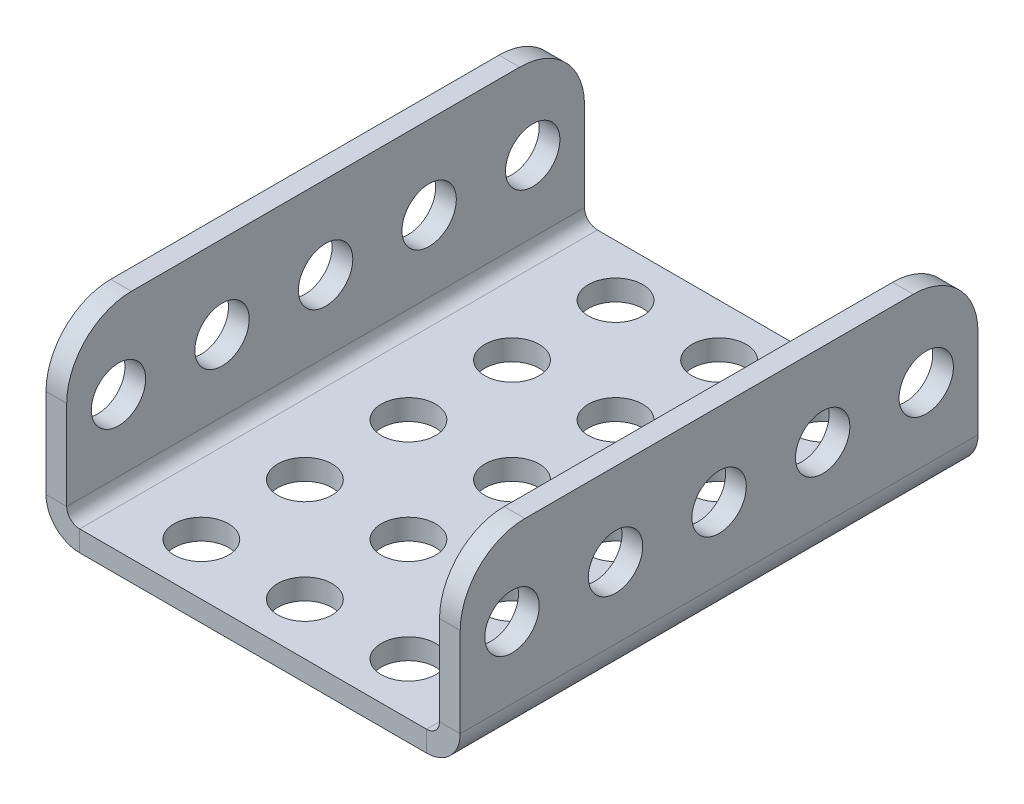
from build123d import *

# Parameters (mm, degrees)
SKETCH1_W                      = 32
SKETCH1_H                      = 40
BOSS_EXTRUDE1_DEPTH            = 1.6
SKETCH2_R                      = 2.1
CUT_EXTRUDE1_DEPTH             = 52.24997561
LPATTERN1_COUNT                = 3
LPATTERN1_PITCH                = 8
LPATTERN1_COUNT_DIR2           = 5
LPATTERN1_PITCH_DIR2           = 8
EDGE_FLANGE1_STRIP_W           = 8.4
EDGE_FLANGE1_STRIP_H           = 1.6
EDGE_FLANGE1_STRIP_CUT_DEPTH   = 40
EDGE_FLANGE1_STRIP_2_W         = 8.4
EDGE_FLANGE1_STRIP_2_H         = 1.6
EDGE_FLANGE1_STRIP_CUT_2_DEPTH = 40
EDGE_FLANGE1_DEPTH             = 40
EDGE_FLANGE1_BEND_DEPTH        = 40
FILLET1_R                      = 5
SKETCH14_R                     = 2.1
CUT_EXTRUDE2_DEPTH             = 54.23767463
LPATTERN2_COUNT                = 5
LPATTERN2_PITCH                = 8


# Sheet-metal steps are written as plain solids
with BuildPart() as part:
    # Sketch1 → Boss-Extrude1 (new body)
    with BuildSketch(Plane(origin=(0, 0, 0), x_dir=(1, 0, 0), z_dir=(0, 1, 0))):
        with Locations((16, -20)):
            Rectangle(SKETCH1_W, SKETCH1_H)
    extrude(amount=BOSS_EXTRUDE1_DEPTH)

    # Sketch2 → Cut-Extrude1 (cut, through all)
    with BuildSketch(Plane(origin=(0, 1.6, 0), x_dir=(1, 0, 0), z_dir=(0, 1, 0))):
        with Locations(Location((8, -4, 0), (0, 0, 270))):
            Circle(SKETCH2_R)
    cut_extrude1 = extrude(amount=-CUT_EXTRUDE1_DEPTH, mode=Mode.SUBTRACT)

    # LPattern1: Cut-Extrude1 3 × 5
    with Locations(*[(i * LPATTERN1_PITCH, 0, j * LPATTERN1_PITCH_DIR2) for i in range(LPATTERN1_COUNT) for j in range(LPATTERN1_COUNT_DIR2) if (i, j) != (0, 0)]):
        add(cut_extrude1, mode=Mode.SUBTRACT)

    # Edge-Flange1 strip (across the edge) → Edge-Flange1 strip cut (cut)
    with BuildSketch(Plane(origin=(32, 1.6, 40), x_dir=(-1, 0, 0), z_dir=(0, 0, -1))):
        with Locations((-1.6, -0.8)):
            Rectangle(EDGE_FLANGE1_STRIP_W, EDGE_FLANGE1_STRIP_H)
    extrude(amount=EDGE_FLANGE1_STRIP_CUT_DEPTH, mode=Mode.SUBTRACT)

    # Edge-Flange1 strip 2 (across the edge) → Edge-Flange1 strip cut 2 (cut)
    with BuildSketch(Plane(origin=(0, 1.6, 0), x_dir=(1, 0, 0), z_dir=(0, 0, 1))):
        with Locations((-1.6, -0.8)):
            Rectangle(EDGE_FLANGE1_STRIP_2_W, EDGE_FLANGE1_STRIP_2_H)
    extrude(amount=EDGE_FLANGE1_STRIP_CUT_2_DEPTH, mode=Mode.SUBTRACT)

    # Edge-Flange1 section (across the edge) → Edge-Flange1 (add)
    with BuildSketch(Plane(origin=(32, 1.6, 40), x_dir=(-1, 0, 0), z_dir=(0, 0, -1))):
        with BuildLine():
            Line((0, 1), (0, 12.9))
            Line((0, 12.9), (1.6, 12.9))
            Line((1.6, 12.9), (1.6, 1))
            ThreePointArc((1.6, 1), (1.892893219, 0.292893219), (2.6, 0))
            Line((2.6, 0), (2.6, -1.6))
            ThreePointArc((2.6, -1.6), (0.761522369, -0.838477631), (0, 1))
        make_face()
    extrude(amount=EDGE_FLANGE1_DEPTH)

    # Edge-Flange1 section 2 (across the edge) → Edge-Flange1 bend (add)
    with BuildSketch(Plane(origin=(0, 1.6, 0), x_dir=(1, 0, 0), z_dir=(0, 0, 1))):
        with BuildLine():
            Line((0, 1), (0, 12.9))
            Line((0, 12.9), (1.6, 12.9))
            Line((1.6, 12.9), (1.6, 1))
            ThreePointArc((1.6, 1), (1.892893219, 0.292893219), (2.6, 0))
            Line((2.6, 0), (2.6, -1.6))
            ThreePointArc((2.6, -1.6), (0.761522369, -0.838477631), (0, 1))
        make_face()
    extrude(amount=EDGE_FLANGE1_BEND_DEPTH)

    # Fillet1
    fillet1_edges = [part.edges().sort_by_distance(p)[0] for p in [
        (31.2, 14.5, 40),
        (31.2, 14.5, 0),
        (0.8, 14.5, 0),
        (0.8, 14.5, 40),
    ]]
    fillet(fillet1_edges, radius=FILLET1_R)

    # Sketch14 → Cut-Extrude2 (cut, through all)
    with BuildSketch(Plane.ZY):
        with Locations(Location((4, 8.1, 0), (0, 0, 270))):
            Circle(SKETCH14_R)
    cut_extrude2 = extrude(amount=-CUT_EXTRUDE2_DEPTH, mode=Mode.SUBTRACT)

    # LPattern2: Cut-Extrude2 ×5
    with Locations(*[(0, 0, i * LPATTERN2_PITCH) for i in range(1, LPATTERN2_COUNT)]):
        add(cut_extrude2, mode=Mode.SUBTRACT)


solid = part.part
